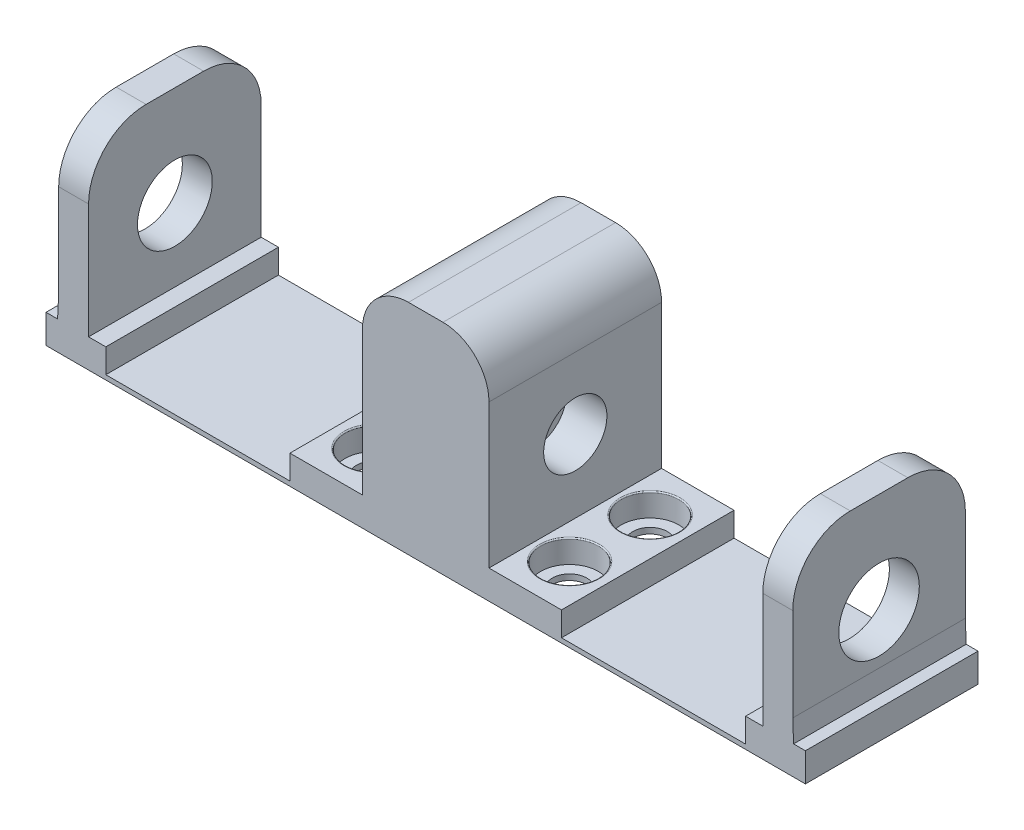
from build123d import *

# Parameters (mm, degrees)
SALIENTE_EXTRUIR1_DEPTH = 15
CROQUIS2_R              = 2.75
CORTAR_EXTRUIR1_DEPTH   = 3.5
CORTAR_EXTRUIR2_START   = -3.5
CROQUIS3_R              = 2.75
CORTAR_EXTRUIR2_DEPTH   = 3.5
CROQUIS4_R              = 2.5
CORTAR_EXTRUIR3_DEPTH   = 2
REDONDEO1_R             = 0.1
CROQUIS5_R              = 1.5
CORTAR_EXTRUIR4_DEPTH   = 26.089838581
CROQUIS6_W              = 15
CROQUIS6_H              = 2.5
SALIENTE_EXTRUIR2_DEPTH = 21.5
CROQUIS7_W              = 15
CROQUIS7_H              = 2.5
SALIENTE_EXTRUIR3_DEPTH = 21.5
CROQUIS8_W              = 2.6
CROQUIS8_H              = 15
SALIENTE_EXTRUIR4_DEPTH = 15
REDONDEO4_R             = 5
REDONDEO5_R             = 5
NERVIO1_REACH           = 37.15
CROQUIS17_WALL_W        = 74.218890724
CROQUIS17_WALL_H        = 15
NERVIO2_REACH           = 37.15
CROQUIS22_WALL_W        = 74.219791664
CROQUIS22_WALL_H        = 15
CROQUIS23_R             = 3.5
CORTAR_EXTRUIR5_DEPTH   = 7
CROQUIS24_R             = 3.25
CORTAR_EXTRUIR6_DEPTH   = 7
CROQUIS34_W             = 16
CROQUIS34_H             = 2.1
CORTAR_EXTRUIR7_DEPTH   = 38.473323845
CROQUIS35_R             = 1.5
CORTAR_EXTRUIR8_DEPTH   = 2.2


with BuildPart() as part:
    # Croquis1 → Saliente-Extruir1 (new body)
    with BuildSketch(Plane.XY):
        with BuildLine():
            Line((-1.5, 9.5), (1.5, 9.5))
            ThreePointArc((1.5, 9.5), (4.328427125, 8.328427125), (5.5, 5.5))
            Line((5.5, 5.5), (5.5, -7))
            Line((5.5, -7), (11.5, -7))
            Line((11.5, -7), (11.5, -9.5))
            Line((11.5, -9.5), (5.5, -9.5))
            Line((5.5, -9.5), (-5.5, -9.5))
            Line((-5.5, -9.5), (-11.5, -9.5))
            Line((-11.5, -9.5), (-11.5, -7))
            Line((-11.5, -7), (-5.5, -7))
            Line((-5.5, -7), (-5.5, 5.5))
            ThreePointArc((-5.5, 5.5), (-4.328427125, 8.328427125), (-1.5, 9.5))
        make_face()
    extrude(amount=-SALIENTE_EXTRUIR1_DEPTH)

    # Croquis2 → Cortar-Extruir1 (cut)
    with BuildSketch(Plane(origin=(5.5, 0, 0), x_dir=(0, 0, -1), z_dir=(1, 0, 0))):
        with Locations((7.5, -0.68)):
            Circle(CROQUIS2_R)
    extrude(amount=-CORTAR_EXTRUIR1_DEPTH, mode=Mode.SUBTRACT)

    # Croquis3 → Cortar-Extruir2 (cut)
    with BuildSketch(Plane.ZY.offset(5.5).offset(CORTAR_EXTRUIR2_START)):
        with Locations((-7.5, -0.68)):
            Circle(CROQUIS3_R)
    extrude(amount=CORTAR_EXTRUIR2_DEPTH, mode=Mode.SUBTRACT)

    # Croquis4 → Cortar-Extruir3 (cut)
    with BuildSketch(Plane(origin=(0, -7, 0), x_dir=(1, 0, 0), z_dir=(0, 1, 0))):
        with Locations((-8.5, 11)):
            Circle(CROQUIS4_R)
        with Locations((-8.5, 4)):
            Circle(CROQUIS4_R)
        with Locations((8.5, 4)):
            Circle(CROQUIS4_R)
        with Locations((8.5, 11)):
            Circle(CROQUIS4_R)
    extrude(amount=-CORTAR_EXTRUIR3_DEPTH, mode=Mode.SUBTRACT)

    # Redondeo1
    redondeo1_edges = [part.edges().sort_by_distance(p)[0] for p in [
        (6, -7, -4),
        (6, -7, -11),
        (-11, -7, -4),
        (-11, -7, -11),
    ]]
    fillet(redondeo1_edges, radius=REDONDEO1_R)

    # Croquis5 → Cortar-Extruir4 (cut, through all)
    with BuildSketch(Plane(origin=(0, -7, 0), x_dir=(1, 0, 0), z_dir=(0, 1, 0))):
        with Locations((-8.5, 11)):
            Circle(CROQUIS5_R)
        with Locations((-8.5, 4)):
            Circle(CROQUIS5_R)
        with Locations((8.5, 4)):
            Circle(CROQUIS5_R)
        with Locations((8.5, 11)):
            Circle(CROQUIS5_R)
    extrude(amount=-CORTAR_EXTRUIR4_DEPTH, mode=Mode.SUBTRACT)

    # Croquis6 → Saliente-Extruir2 (add)
    with BuildSketch(Plane.ZY.offset(11.5)):
        with Locations((-7.5, -8.25)):
            Rectangle(CROQUIS6_W, CROQUIS6_H)
    extrude(amount=SALIENTE_EXTRUIR2_DEPTH)

    # Croquis7 → Saliente-Extruir3 (add)
    with BuildSketch(Plane(origin=(11.5, 0, 0), x_dir=(0, 0, -1), z_dir=(1, 0, 0))):
        with Locations((7.5, -8.25)):
            Rectangle(CROQUIS7_W, CROQUIS7_H)
    extrude(amount=SALIENTE_EXTRUIR3_DEPTH)

    # Croquis8 → Saliente-Extruir4 (add)
    with BuildSketch(Plane(origin=(0, -7, 0), x_dir=(1, 0, 0), z_dir=(0, 1, 0))):
        with Locations((-30.6, 7.5)):
            Rectangle(CROQUIS8_W, CROQUIS8_H)
        with Locations((30.6, 7.5)):
            Rectangle(CROQUIS8_W, CROQUIS8_H)
    extrude(amount=SALIENTE_EXTRUIR4_DEPTH)

    # Redondeo4
    redondeo4_edges = [part.edges().sort_by_distance(p)[0] for p in [
        (-30.6, 8, -15),
        (-30.6, 8, 0),
    ]]
    fillet(redondeo4_edges, radius=REDONDEO4_R)

    # Redondeo5
    redondeo5_edges = [part.edges().sort_by_distance(p)[0] for p in [
        (30.6, 8, -15),
        (30.6, 8, 0),
    ]]
    fillet(redondeo5_edges, radius=REDONDEO5_R)

    # Croquis17 wall → Nervio1 (add, up to next)
    with BuildSketch(Plane(origin=(31.936186969, -6.040917019, -7.5), x_dir=(0.037703973023, -0.999288952415, 0), z_dir=(0.999288952415, 0.037703973023, 0)), mode=Mode.PRIVATE) as nervio1_sk1:
        Rectangle(CROQUIS17_WALL_W, CROQUIS17_WALL_H)
    nervio1_tool1 = extrude(nervio1_sk1.sketch, amount=-NERVIO1_REACH, mode=Mode.PRIVATE) - part.part
    add(nervio1_tool1.solids().sort_by_distance((31.936186969, -6.040917019, -7.5))[0])

    # Croquis22 wall → Nervio2 (add, up to next)
    with BuildSketch(Plane(origin=(-31.946630364, -6.040917019, -7.5), x_dir=(0.048562374867, 0.998820151853, 0), z_dir=(-0.998820151853, 0.048562374867, 0)), mode=Mode.PRIVATE) as nervio2_sk1:
        Rectangle(CROQUIS22_WALL_W, CROQUIS22_WALL_H)
    nervio2_tool1 = extrude(nervio2_sk1.sketch, amount=-NERVIO2_REACH, mode=Mode.PRIVATE) - part.part
    add(nervio2_tool1.solids().sort_by_distance((-31.946630364, -6.040917019, -7.5))[0])

    # Croquis23 → Cortar-Extruir5 (cut)
    with BuildSketch(Plane(origin=(31.9, 0, 0), x_dir=(0, 0, -1), z_dir=(1, 0, 0))):
        with Locations((7.5, -0.68)):
            Circle(CROQUIS23_R)
    extrude(amount=-CORTAR_EXTRUIR5_DEPTH, mode=Mode.SUBTRACT)

    # Croquis24 → Cortar-Extruir6 (cut)
    with BuildSketch(Plane.ZY.offset(31.9)):
        with Locations((-7.5, -0.68)):
            Circle(CROQUIS24_R)
    extrude(amount=-CORTAR_EXTRUIR6_DEPTH, mode=Mode.SUBTRACT)

    # Croquis34 → Cortar-Extruir7 (cut, through all)
    with BuildSketch(Plane.XY):
        with Locations((-19.8, -8.05)):
            Rectangle(CROQUIS34_W, CROQUIS34_H)
        with Locations((19.8, -8.05)):
            Rectangle(CROQUIS34_W, CROQUIS34_H)
    extrude(amount=-CORTAR_EXTRUIR7_DEPTH, mode=Mode.SUBTRACT)

    # Croquis35 → Cortar-Extruir8 (cut)
    with BuildSketch(Plane.XZ.offset(9.5)):
        with Locations((-31, -4)):
            Circle(CROQUIS35_R)
        with Locations((-31, -11)):
            Circle(CROQUIS35_R)
        with Locations((31, -11)):
            Circle(CROQUIS35_R)
        with Locations((31, -4)):
            Circle(CROQUIS35_R)
    extrude(amount=-CORTAR_EXTRUIR8_DEPTH, mode=Mode.SUBTRACT)


solid = part.part
